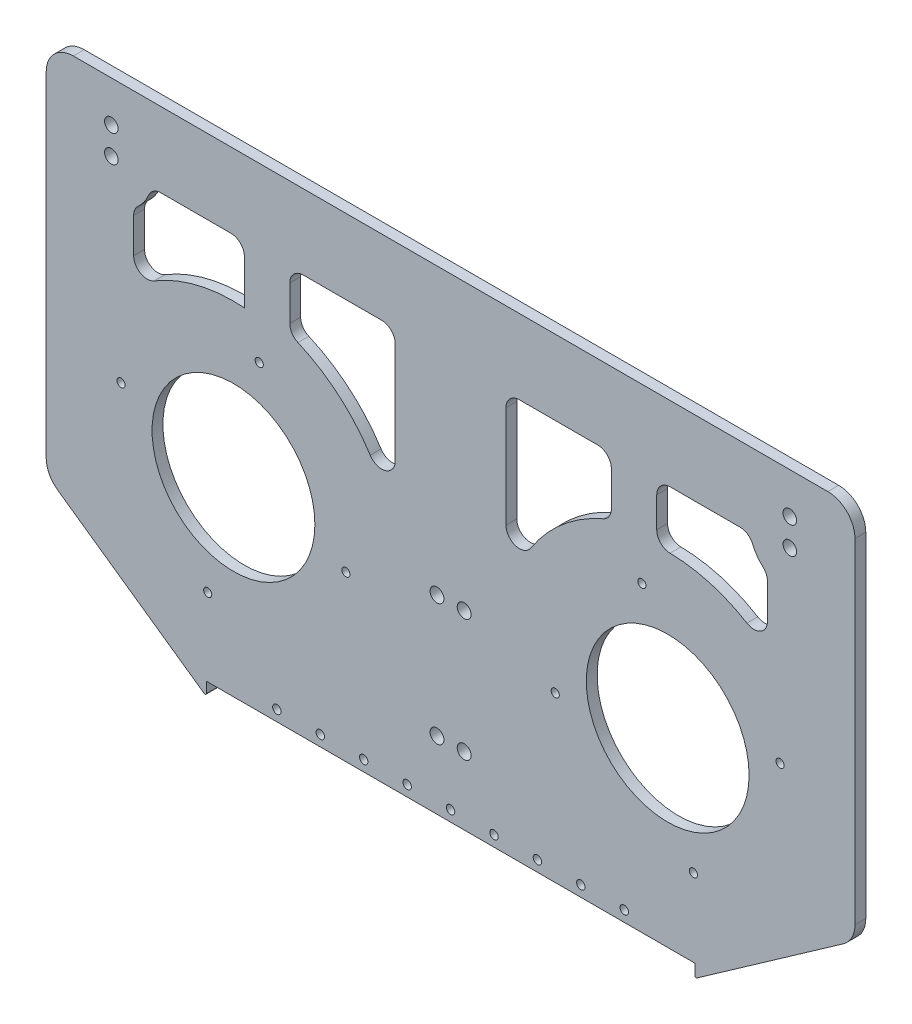
from build123d import *

# Parameters (mm, degrees)
SKETCH1_R           = 2.55
SKETCH1_R_2         = 2.5
BOSS_EXTRUDE1_DEPTH = 4
SKETCH2_R           = 1.5
SKETCH2_R_2         = 30
CUT_EXTRUDE1_DEPTH  = 10
SKETCH3_R           = 1.55
CUT_EXTRUDE2_DEPTH  = 192.355689751
CUT_EXTRUDE3_DEPTH  = 192.355689751
FILLET1_R           = 5
FILLET2_R           = 0.5
FILLET3_R           = 10


with BuildPart() as part:
    # Sketch1 → Boss-Extrude1 (new body)
    with BuildSketch(Plane.XY):
        Polygon((-90, -59.887336036), (-90, -55), (90, -55), (90, -59.887336036), (149, -18.466211936), (149, 120), (145, 120), (-145, 120), (-149, 120), (-149, -18.466211936), align=None)
        with Locations((-5, -30)):
            Circle(SKETCH1_R, mode=Mode.SUBTRACT)
        with Locations((-5, 15)):
            Circle(SKETCH1_R, mode=Mode.SUBTRACT)
        with Locations((5, -30)):
            Circle(SKETCH1_R, mode=Mode.SUBTRACT)
        with Locations((5, 15)):
            Circle(SKETCH1_R, mode=Mode.SUBTRACT)
        with Locations((-125, 95)):
            Circle(SKETCH1_R_2, mode=Mode.SUBTRACT)
        with Locations((-125, 105)):
            Circle(SKETCH1_R_2, mode=Mode.SUBTRACT)
        with Locations((125, 95)):
            Circle(SKETCH1_R_2, mode=Mode.SUBTRACT)
        with Locations((125, 105)):
            Circle(SKETCH1_R_2, mode=Mode.SUBTRACT)
    extrude(amount=BOSS_EXTRUDE1_DEPTH)

    # Sketch2 → Cut-Extrude1 (cut)
    with BuildSketch(Plane.XY.offset(4)):
        with Locations((38.573620895, 5.507628631)):
            Circle(SKETCH2_R)
        with Locations((70.507628631, 56.426379105)):
            Circle(SKETCH2_R)
        with Locations((121.426379105, 24.492371369)):
            Circle(SKETCH2_R)
        with Locations((89.492371369, -26.426379105)):
            Circle(SKETCH2_R)
        with Locations((80, 15)):
            Circle(SKETCH2_R_2)
        with Locations((-38.573620895, 5.507628631)):
            Circle(SKETCH2_R)
        with Locations((-70.507628631, 56.426379105)):
            Circle(SKETCH2_R)
        with Locations((-89.492371369, -26.426379105)):
            Circle(SKETCH2_R)
        with Locations((-121.426379105, 24.492371369)):
            Circle(SKETCH2_R)
        with Locations((-80, 15)):
            Circle(SKETCH2_R_2)
    extrude(amount=-CUT_EXTRUDE1_DEPTH, mode=Mode.SUBTRACT)

    # Sketch3 → Cut-Extrude2 (cut, through all)
    with BuildSketch(Plane.XY.offset(4)):
        with Locations((-64, -51)):
            Circle(SKETCH3_R)
        with Locations((-48, -51)):
            Circle(SKETCH3_R)
        with Locations((-32, -51)):
            Circle(SKETCH3_R)
        with Locations((-16, -51)):
            Circle(SKETCH3_R)
        with Locations((0, -51)):
            Circle(SKETCH3_R)
        with Locations((16, -51)):
            Circle(SKETCH3_R)
        with Locations((32, -51)):
            Circle(SKETCH3_R)
        with Locations((48, -51)):
            Circle(SKETCH3_R)
        with Locations((64, -51)):
            Circle(SKETCH3_R)
    extrude(amount=-CUT_EXTRUDE2_DEPTH, mode=Mode.SUBTRACT)

    # Sketch6 → Cut-Extrude3 (cut, through all)
    with BuildSketch(Plane(origin=(0, 0, 0), x_dir=(-1, 0, 0), z_dir=(0, 0, -1))):
        with BuildLine():
            ThreePointArc((-59.239754761, 71.135764515), (-32.477390126, 51.384246466), (-20.392124849, 20.395651962))
            Line((-20.392124849, 20.395651962), (-20.392124849, 92.456219591))
            Line((-20.392124849, 92.456219591), (-59.239754761, 92.456219591))
            Line((-59.239754761, 92.456219591), (-59.239754761, 71.135764515))
        make_face()
        with BuildLine():
            Line((-75.962334301, 71.135764515), (-75.962334301, 92.456219591))
            Line((-75.962334301, 92.456219591), (-110.419712469, 92.456219591))
            ThreePointArc((-110.419712469, 92.456219591), (-112.597288394, 86.923593121), (-116.776447851, 82.694359289))
            Line((-116.776447851, 82.694359289), (-116.776447851, 57.603047842))
            ThreePointArc((-116.776447851, 57.603047842), (-97.712723375, 68.420840808), (-75.962334301, 71.135764515))
        make_face()
        with BuildLine():
            Line((20.392124849, 92.456219591), (20.392124849, 20.395651962))
            ThreePointArc((20.392124849, 20.395651962), (32.477390126, 51.384246466), (59.239754761, 71.135764515))
            Line((59.239754761, 71.135764515), (59.239754761, 92.456219591))
            Line((59.239754761, 92.456219591), (20.392124849, 92.456219591))
        make_face()
        with BuildLine():
            Line((110.419712469, 92.456219591), (75.962334301, 92.456219591))
            Line((75.962334301, 92.456219591), (75.962334301, 71.135764515))
            ThreePointArc((75.962334301, 71.135764515), (97.712723375, 68.420840808), (116.776447851, 57.603047842))
            Line((116.776447851, 57.603047842), (116.776447851, 82.694359289))
            ThreePointArc((116.776447851, 82.694359289), (112.597288394, 86.923593121), (110.419712469, 92.456219591))
        make_face()
    extrude(amount=-CUT_EXTRUDE3_DEPTH, mode=Mode.SUBTRACT)

    # Fillet1
    fillet1_edges = [part.edges().sort_by_distance(p)[0] for p in [
        (-59.239754761, 92.456219591, 2),
        (-110.419712469, 92.456219591, 2),
        (-116.776447851, 82.694359289, 2),
        (-59.239754761, 71.135764515, 2),
        (-116.776447851, 57.603047842, 2),
        (-75.962334301, 92.456219591, 2),
        (-20.392124849, 92.456219591, 2),
        (-20.392124849, 20.395651962, 2),
        (20.392124849, 20.395651962, 2),
        (59.239754761, 92.456219591, 2),
        (59.239754761, 71.135764515, 2),
        (20.392124849, 92.456219591, 2),
        (75.962334301, 92.456219591, 2),
        (75.962334301, 71.135764515, 2),
        (110.419712469, 92.456219591, 2),
        (116.776447851, 82.694359289, 2),
        (116.776447851, 57.603047842, 2),
    ]]
    fillet(fillet1_edges, radius=FILLET1_R)

    # Fillet2
    fillet2_edges = [part.edges().sort_by_distance(p)[0] for p in [
        (90, -59.887336036, 2),
        (-90, -59.887336036, 2),
    ]]
    fillet(fillet2_edges, radius=FILLET2_R)

    # Fillet3
    fillet3_edges = [part.edges().sort_by_distance(p)[0] for p in [
        (149, -18.466211936, 2),
        (149, 120, 2),
        (-149, 120, 2),
        (-149, -18.466211936, 2),
    ]]
    fillet(fillet3_edges, radius=FILLET3_R)


solid = part.part
